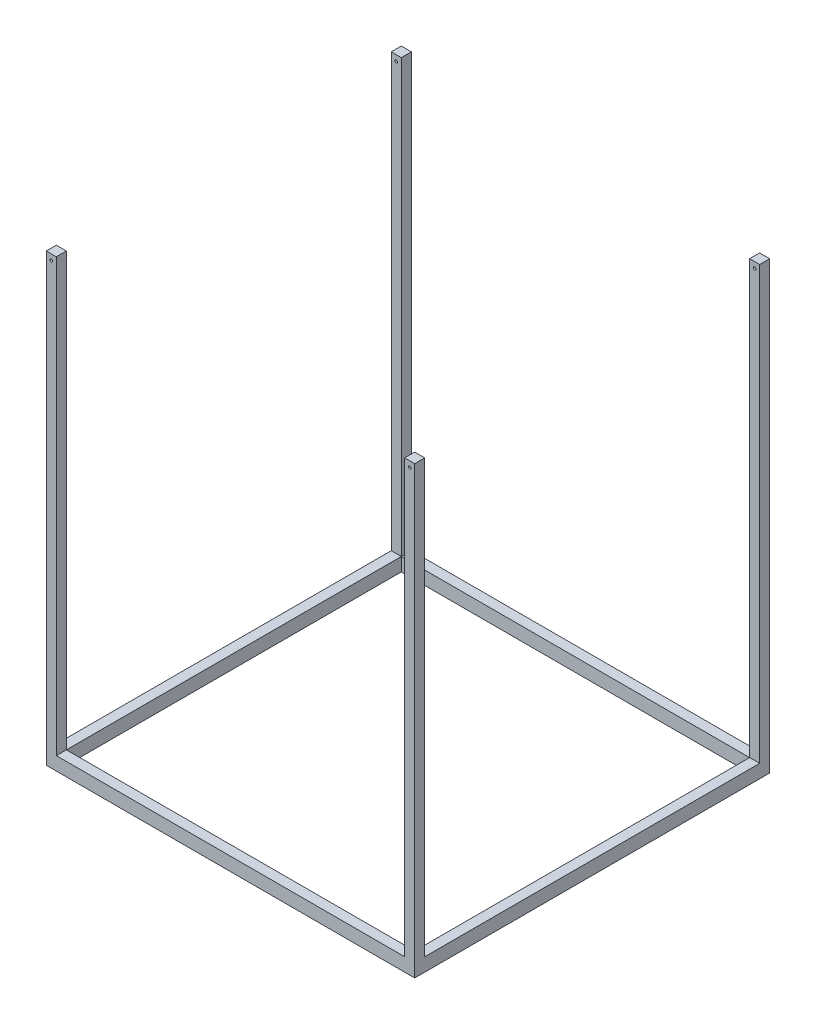
from build123d import *

# Parameters (mm, degrees)
SKETCH1_W               = 1397
SKETCH1_H               = 1346.2
SKETCH1_W_2             = 1320.8
SKETCH1_H_2             = 1270
BOSS_EXTRUDE1_DEPTH     = 50.8
SKETCH1_3_W             = 38.1
SKETCH1_3_H             = 38.1
BOSS_EXTRUDE2_DEPTH     = 1689.1
F_3_8_CLEARANCE_HOLE1_D = 10.0838
F_3_8_CLEARANCE_HOLE2_D = 10.0838


with BuildPart() as part:
    # Sketch1 → Boss-Extrude1 (new body)
    with BuildSketch(Plane(origin=(0, 0, 0), x_dir=(1, 0, 0), z_dir=(0, 1, 0))):
        Rectangle(SKETCH1_W, SKETCH1_H)
        Rectangle(SKETCH1_W_2, SKETCH1_H_2, mode=Mode.SUBTRACT)
    extrude(amount=BOSS_EXTRUDE1_DEPTH)

    # Sketch1<3> → Boss-Extrude2 (add)
    with BuildSketch(Plane(origin=(0, 0, 0), x_dir=(1, 0, 0), z_dir=(0, 1, 0))):
        with Locations((-679.45, 654.05)):
            Rectangle(SKETCH1_3_W, SKETCH1_3_H)
        with Locations((-679.45, -654.05)):
            Rectangle(SKETCH1_3_W, SKETCH1_3_H)
        with Locations((679.45, 654.05)):
            Rectangle(SKETCH1_3_W, SKETCH1_3_H)
        with Locations((679.45, -654.05)):
            Rectangle(SKETCH1_3_W, SKETCH1_3_H)
    extrude(amount=BOSS_EXTRUDE2_DEPTH)

    # 3/8 Clearance Hole1 (through all)
    with Locations(Plane.XY.offset(673.1)):
        with Locations((-679.45, 1666.93596)):
            Hole(F_3_8_CLEARANCE_HOLE1_D / 2)

    # 3/8 Clearance Hole2 (through all)
    with Locations(Plane.XY.offset(673.1)):
        with Locations((679.45, 1666.93596)):
            Hole(F_3_8_CLEARANCE_HOLE2_D / 2)


solid = part.part
